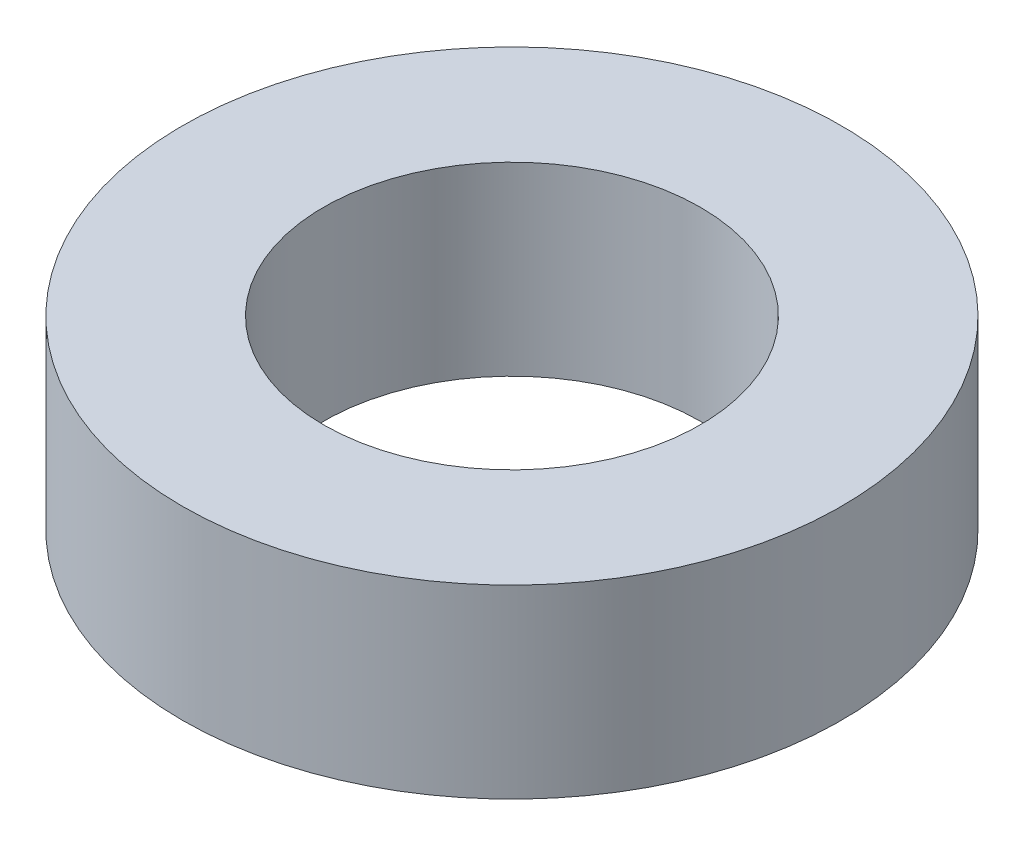
from build123d import *

# Parameters (mm, degrees)
SKETCH1_R           = 5.334
SKETCH1_R_2         = 3.05
BOSS_EXTRUDE1_DEPTH = 3


with BuildPart() as part:
    # Sketch1 → Boss-Extrude1 (new body)
    with BuildSketch(Plane(origin=(0, 0, 0), x_dir=(1, 0, 0), z_dir=(0, 1, 0))):
        Circle(SKETCH1_R)
        Circle(SKETCH1_R_2, mode=Mode.SUBTRACT)
    extrude(amount=BOSS_EXTRUDE1_DEPTH)


solid = part.part
